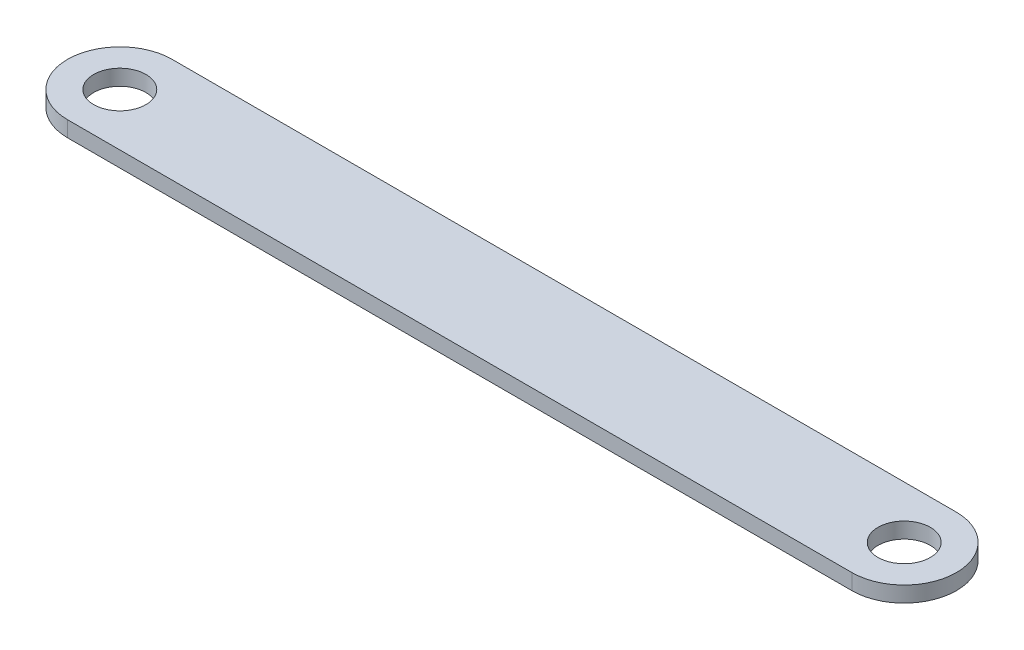
from build123d import *

# Parameters (mm, degrees)
SKETCH_1_R      = 5
EXTRUDE_1_DEPTH = 3


with BuildPart() as part:
    # 草图1 → 凸台-拉伸1 (new body)
    with BuildSketch(Plane(origin=(0, 0, 0), x_dir=(1, 0, 0), z_dir=(0, 1, 0))):
        with BuildLine():
            Line((0, 10), (150, 10))
            ThreePointArc((150, 10), (160, 0), (150, -10))
            Line((150, -10), (0, -10))
            ThreePointArc((0, -10), (-10, 0), (0, 10))
        make_face()
        Circle(SKETCH_1_R, mode=Mode.SUBTRACT)
        with Locations((150, 0)):
            Circle(SKETCH_1_R, mode=Mode.SUBTRACT)
    extrude(amount=EXTRUDE_1_DEPTH)


solid = part.part
